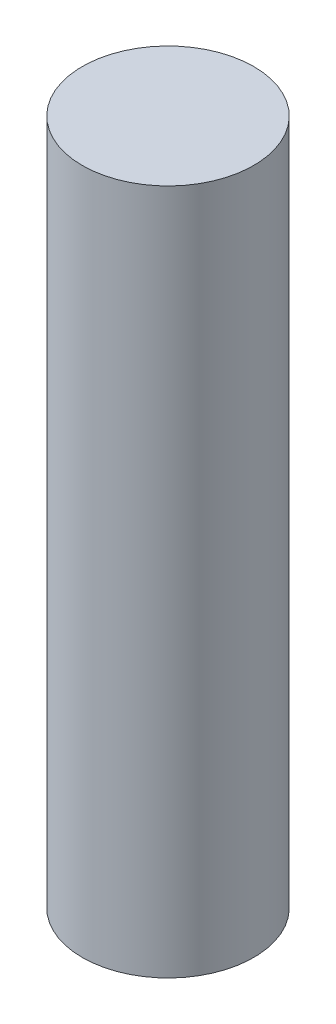
from build123d import *

# Parameters (mm, degrees)
SKETCH1_R           = 2.5
BOSS_EXTRUDE1_DEPTH = 20


with BuildPart() as part:
    # Sketch1 → Boss-Extrude1 (new body)
    with BuildSketch(Plane(origin=(0, 0, 0), x_dir=(1, 0, 0), z_dir=(0, 1, 0))):
        Circle(SKETCH1_R)
    extrude(amount=BOSS_EXTRUDE1_DEPTH)


solid = part.part
